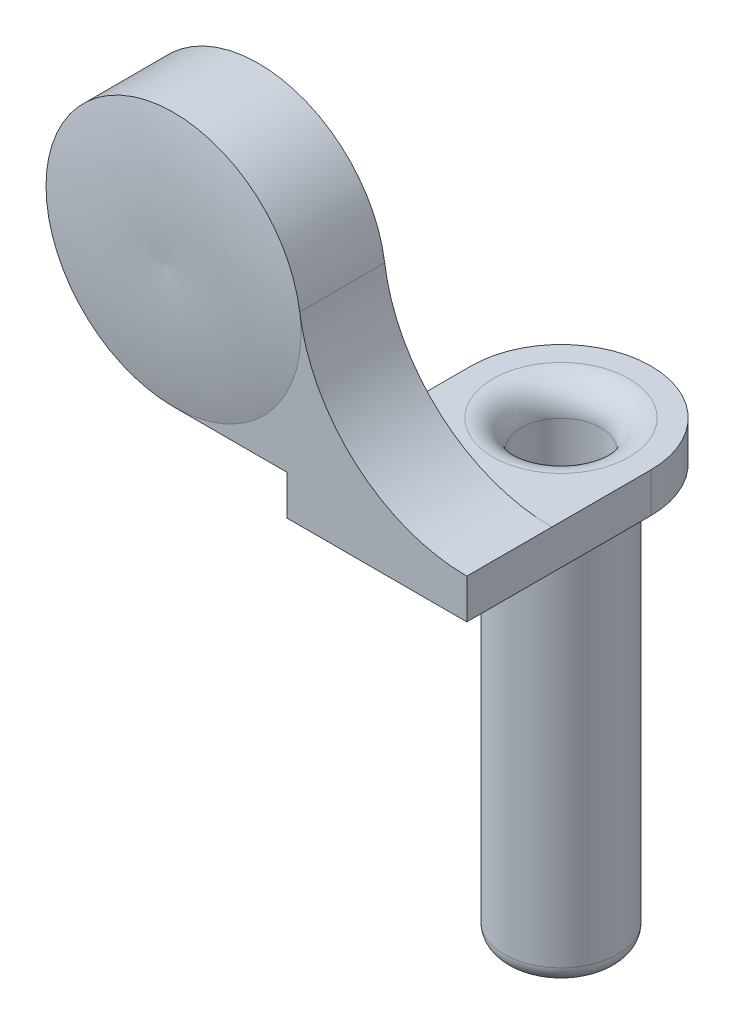
from build123d import *

# Parameters (mm, degrees)
SKETCH_1_R               = 2
EXTRUDE_1_DEPTH          = 16
EXTRUDE_2_DEPTH          = 3
SKETCH_4_R               = 3.15
CUT_EXTRUDE_6_DEPTH      = 2.775
FILLET_3_R               = 0.6
SKETCH_7_R               = 3.175
EXTRUDE_3_DEPTH          = 1.4
CUT_EXTRUDE_9_DEPTH      = 29.349116388
CUT_EXTRUDE_9_DEPTH_BACK = 29.349116388
SKETCH_10_R              = 1.4
FILLET_6_R               = 1
EXTRUDE_4_REACH          = 31.241
EXTRUDE_4_END_RADIUS     = 3.175
SKETCH_13_W              = 6.35
SKETCH_13_H              = 1.4
FILLET_8_R               = 0.3
CUT_EXTRUDE_12_REACH     = 30.39


with BuildPart() as part:
    # 草图1 → 凸台-拉伸1 (new body)
    with BuildSketch(Plane(origin=(0, 0, 0), x_dir=(1, 0, 0), z_dir=(0, 1, 0))):
        Circle(SKETCH_1_R)
    extrude(amount=EXTRUDE_1_DEPTH)

    # 圆角3
    fillet_3_edges = [part.edges().sort_by_distance(p)[0] for p in [
        (-2, 0, 0),
    ]]
    fillet(fillet_3_edges, radius=FILLET_3_R)

    # 草图7 → 凸台-拉伸3 (add)
    with BuildSketch(Plane(origin=(0, 16, 0), x_dir=(1, 0, 0), z_dir=(0, 1, 0))):
        Circle(SKETCH_7_R)
    extrude(amount=-EXTRUDE_3_DEPTH)

    # 草图10 → 切除-拉伸9 (cut, two sides: drawn at the far end of the back side and taken through both)
    with BuildSketch(Plane.XZ.offset(-CUT_EXTRUDE_9_DEPTH_BACK)):
        Circle(SKETCH_10_R)
    extrude(amount=CUT_EXTRUDE_9_DEPTH + CUT_EXTRUDE_9_DEPTH_BACK, mode=Mode.SUBTRACT)

    # 圆角6
    fillet_6_edges = [part.edges().sort_by_distance(p)[0] for p in [
        (-1.4, 16, 0),
    ]]
    fillet(fillet_6_edges, radius=FILLET_6_R)


with BuildPart() as body_2:
    # 草图2 → 凸台-拉伸2 (new body)
    with BuildSketch(Plane.XY.offset(3.5)):
        with BuildLine():
            Line((3.175, 16), (-3.890146084, 23.570319399))
            ThreePointArc((-3.890146084, 23.570319399), (-11.307132012, 22.293538779), (-7.18, 16))
            Line((-7.18, 16), (3.175, 16))
        make_face()
    extrude(amount=EXTRUDE_2_DEPTH)

    # 草图4 → 切除-拉伸6 (cut)
    with BuildSketch(Plane(origin=(0, 0, 3.5), x_dir=(-1, 0, 0), z_dir=(0, 0, -1))):
        with Locations((7.18, 20.5)):
            Circle(SKETCH_4_R)
    extrude(amount=-CUT_EXTRUDE_6_DEPTH, mode=Mode.SUBTRACT)



with BuildPart() as body_3:
    # 草图12 → 旋转1 (revolve)
    with BuildSketch(Plane(origin=(0, 20.5, 0), x_dir=(-1, 0, 0), z_dir=(0, -1, 0))):
        with BuildLine():
            Line((7.18, -6.5), (7.18, -6.8))
            ThreePointArc((7.18, -6.8), (9.440729309, -6.810939628), (11.68, -6.5))
            Line((11.68, -6.5), (7.18, -6.5))
        make_face()
    revolve(axis=Axis((-7.18, 20.5, 6.5), (0, 0, 1)))


with BuildPart() as body_2_1:
    add(body_2.part)

    add(body_3.part)  # 凸台-拉伸4 merges body 3

    add(part.part)  # 凸台-拉伸4 merges part
    # 凸台-拉伸4: up to this cylinder (the profile starts outside it)
    extrude_4_end = Plane(origin=(0, 15.3, 0), z_dir=(0, 1, 0)) * Cylinder(EXTRUDE_4_END_RADIUS, 69.832, mode=Mode.PRIVATE)
    # 草图13 → 凸台-拉伸4 (add, up to the surface)
    with BuildSketch(Plane.XY.offset(6.5), mode=Mode.PRIVATE) as extrude_4_sk1:
        with Locations((0, 15.3)):
            Rectangle(SKETCH_13_W, SKETCH_13_H)
    extrude_4_tool1 = extrude(extrude_4_sk1.sketch, amount=-EXTRUDE_4_REACH, mode=Mode.PRIVATE) - extrude_4_end
    add(extrude_4_tool1.solids().sort_by_distance((0, 15.3, 6.5))[0])

    # 圆角8
    fillet_8_edges = [body_2_1.edges().sort_by_distance(p)[0] for p in [
        (-4.03, 20.5, 3.5),
    ]]
    fillet(fillet_8_edges, radius=FILLET_8_R)

    # 草图15 → 切除-拉伸12 (cut, up to next)
    with BuildSketch(Plane(origin=(0, 0, 3.5), x_dir=(-1, 0, 0), z_dir=(0, 0, -1)), mode=Mode.PRIVATE) as cut_extrude_12_sk1:
        with BuildLine():
            Line((3.890146084, 23.570319399), (-3.175, 16))
            ThreePointArc((-3.175, 16), (0.732782425, 17.460880609), (2.723894634, 21.126996785))
            ThreePointArc((2.723894634, 21.126996785), (3.118912997, 22.43844586), (3.890146084, 23.570319399))
        make_face()
    cut_extrude_12_tool1 = extrude(cut_extrude_12_sk1.sketch, amount=-CUT_EXTRUDE_12_REACH, mode=Mode.PRIVATE) & body_2_1.part
    add(cut_extrude_12_tool1.solids().sort_by_distance((-0.41857, 18.744039, 3.5))[0], mode=Mode.SUBTRACT)


solid = body_2_1.part
